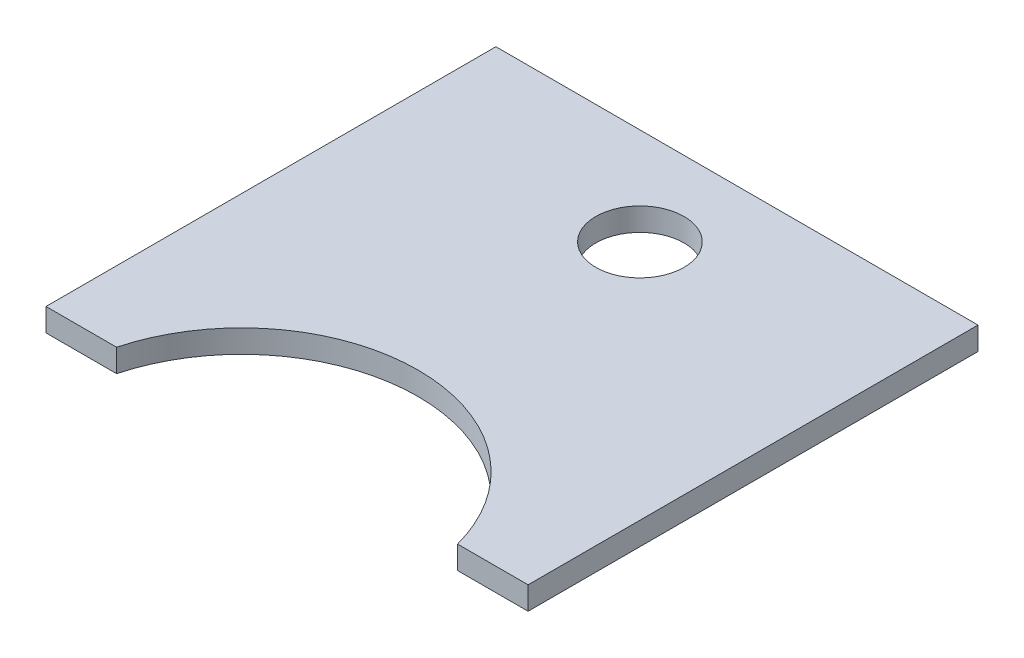
from build123d import *

# Parameters (mm, degrees)
SKETCH1_R           = 3.175
BOSS_EXTRUDE1_DEPTH = 1.651


with BuildPart() as part:
    # Sketch1 → Boss-Extrude1 (new body)
    with BuildSketch(Plane(origin=(0, 0, 0), x_dir=(1, 0, 0), z_dir=(0, 1, 0))):
        with BuildLine():
            Line((-17.351285359, 3.27193454), (-12.271285359, 3.27193454))
            ThreePointArc((-12.271285359, 3.27193454), (0, 12.7), (12.271285359, 3.27193454))
            Line((12.271285359, 3.27193454), (17.351285359, 3.27193454))
            Line((17.351285359, 3.27193454), (17.351285359, 35.65693454))
            Line((17.351285359, 35.65693454), (-17.351285359, 35.65693454))
            Line((-17.351285359, 35.65693454), (-17.351285359, 3.27193454))
        make_face()
        with Locations((0, 28.67193454)):
            Circle(SKETCH1_R, mode=Mode.SUBTRACT)
    extrude(amount=BOSS_EXTRUDE1_DEPTH)


solid = part.part
